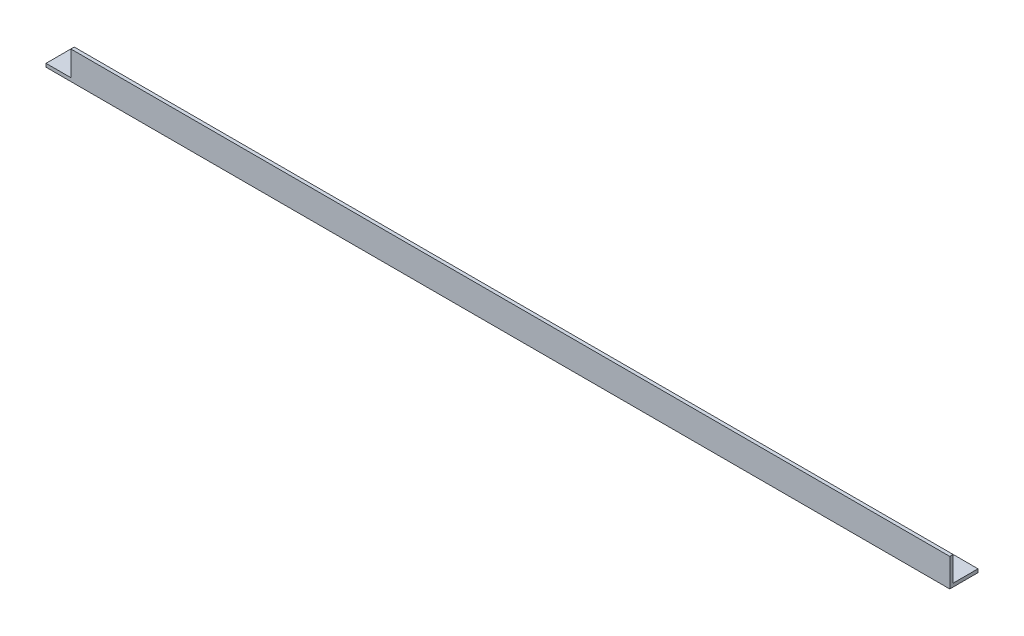
from build123d import *

# Parameters (mm, degrees)
EXTRUDE_1_DEPTH     = 800
SKETCH_2_W          = 22
SKETCH_2_H          = 22
CUT_EXTRUDE_1_DEPTH = 801.780868902


with BuildPart() as part:
    # Эскиз1 → Вытянуть-Тонкостенный1 (new body)
    with BuildSketch(Plane(origin=(0, 0, 0), x_dir=(0, 0, -1), z_dir=(1, 0, 0))):
        Polygon((0, 25), (0, 0), (25, 0), (25, 3), (3, 3), (3, 25), align=None)
    extrude(amount=EXTRUDE_1_DEPTH)

    # Эскиз2 → Вырез-Вытянуть1 (cut, through all)
    with BuildSketch(Plane.XY):
        with Locations((11, 14)):
            Rectangle(SKETCH_2_W, SKETCH_2_H)
    extrude(amount=-CUT_EXTRUDE_1_DEPTH, mode=Mode.SUBTRACT)


solid = part.part
